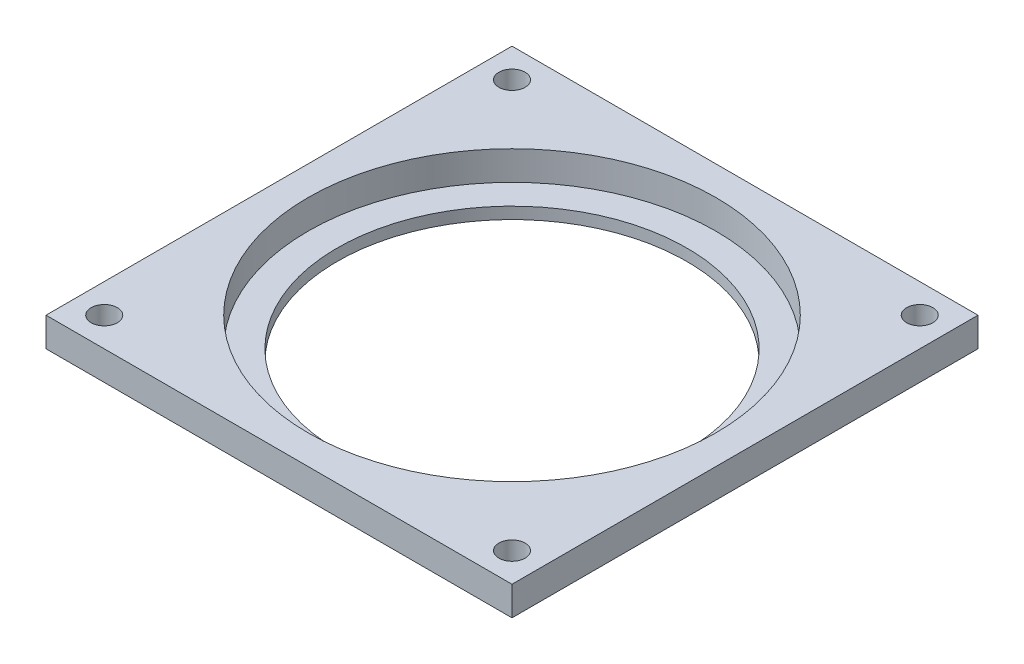
from build123d import *

# Parameters (mm, degrees)
SKETCH1_R           = 35
SKETCH1_R_2         = 30
BOSS_EXTRUDE1_DEPTH = 2
SKETCH2_W           = 80
SKETCH2_H           = 80
SKETCH2_R           = 2.25
SKETCH2_R_2         = 35
BOSS_EXTRUDE2_DEPTH = 5


with BuildPart() as part:
    # Sketch1 → Boss-Extrude1 (new body)
    with BuildSketch(Plane(origin=(0, 0, 0), x_dir=(1, 0, 0), z_dir=(0, 1, 0))):
        Circle(SKETCH1_R)
        Circle(SKETCH1_R_2, mode=Mode.SUBTRACT)
    extrude(amount=BOSS_EXTRUDE1_DEPTH)


with BuildPart() as body_2:
    # Sketch2 → Boss-Extrude2 (new body)
    with BuildSketch(Plane(origin=(0, 2, 0), x_dir=(1, 0, 0), z_dir=(0, 1, 0))):
        Rectangle(SKETCH2_W, SKETCH2_H)
        with Locations((-35, -35)):
            Circle(SKETCH2_R, mode=Mode.SUBTRACT)
        Circle(SKETCH2_R_2, mode=Mode.SUBTRACT)
        with Locations((35, -35)):
            Circle(SKETCH2_R, mode=Mode.SUBTRACT)
        with Locations((35, 35)):
            Circle(SKETCH2_R, mode=Mode.SUBTRACT)
        with Locations((-35, 35)):
            Circle(SKETCH2_R, mode=Mode.SUBTRACT)
    extrude(amount=BOSS_EXTRUDE2_DEPTH)


solid = Compound([part.part, body_2.part])
